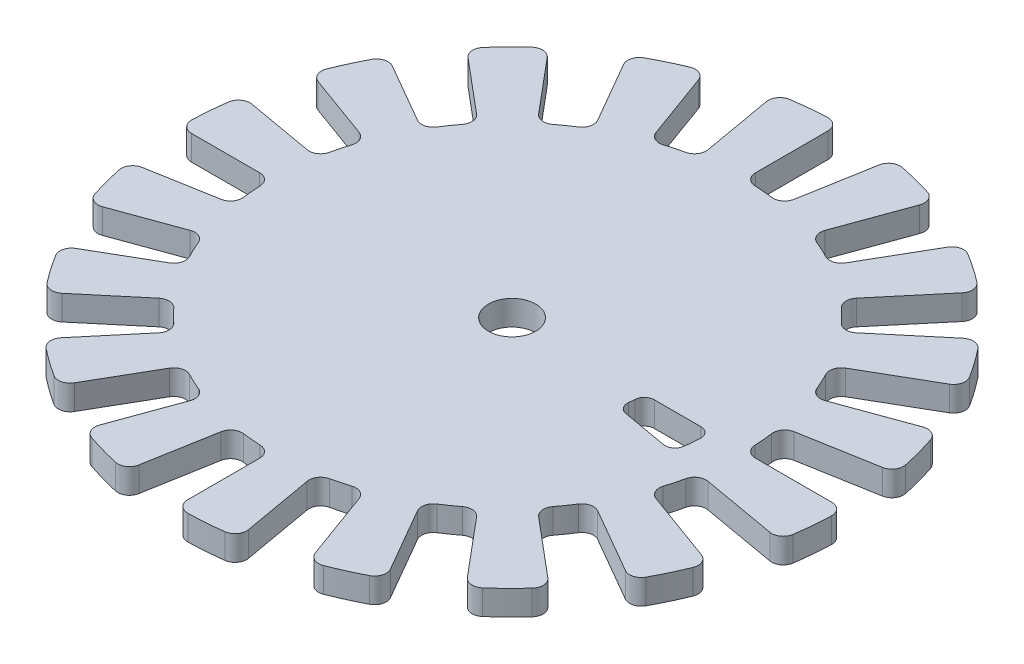
from build123d import *

# Parameters (mm, degrees)
SKETCH1_R               = 20
BASE_FLANGE1_DEPTH      = 1.5
CUT_EXTRUDE1_DEPTH      = 29.324018077
FILLET2_R               = 0.7
CIRPATTERN1_START       = -1.5
CIRPATTERN1_DEPTH       = 1.5
CUT_EXTRUDE2_DEPTH      = 29.312718395
CUT_EXTRUDE2_DEPTH_BACK = 29.312718395
SKETCH9_R               = 1.425
CUT_EXTRUDE3_DEPTH      = 29.312718395
CUT_EXTRUDE3_DEPTH_BACK = 29.312718395
FILLET3_R               = 0.6


# Read off the part's stored shape, not the designer's step: CirPattern1
# Sheet-metal steps are written as plain solids
with BuildPart() as part:
    # Sketch1 → Base-Flange1 (new body)
    with BuildSketch(Plane(origin=(0, 0, 0), x_dir=(1, 0, 0), z_dir=(0, 1, 0))):
        with Locations(Location((0, 0, 0), (0, 0, 270))):
            Circle(SKETCH1_R)
    extrude(amount=-BASE_FLANGE1_DEPTH)

    # Sketch8 → Cut-Extrude1 (cut, symmetric)
    with BuildSketch(Plane(origin=(0, 0, 0), x_dir=(1, 0, 0), z_dir=(0, 1, 0))):
        with BuildLine():
            Line((13.787308542, 2.431074487), (19.69615506, 3.472963553))
            ThreePointArc((19.69615506, 3.472963553), (19.923893962, 1.743114855), (20, 0))
            Line((20, 0), (14, 0))
            ThreePointArc((14, 0), (13.946725773, 1.220180398), (13.787308542, 2.431074487))
        make_face()
    extrude(amount=CUT_EXTRUDE1_DEPTH, both=True, mode=Mode.SUBTRACT)

    # Fillet2
    fillet2_edges = [part.edges().sort_by_distance(p)[0] for p in [
        (19.69615506, -0.75, -3.472963553),
        (20, -0.75, 0),
        (14, -0.75, 0),
        (13.787308542, -0.75, -2.431074487),
    ]]
    fillet(fillet2_edges, radius=FILLET2_R)

    # CirPattern1 outline → CirPattern1 (cut)
    with BuildSketch(Plane(origin=(0, 0, 0), x_dir=(1, 0, 0), z_dir=(0, 1, 0)).offset(CIRPATTERN1_START)):
        with BuildLine():
            ThreePointArc((12.890480997, 5.492454574), (13.255479493, 5.121639026), (13.775533049, 5.105135328))
            Line((13.775533049, 5.105135328), (18.097552381, 6.678221717))
            ThreePointArc((18.097552381, 6.678221717), (18.642858692, 6.650063721), (19.002037805, 6.238794697))
            ThreePointArc((19.002037805, 6.238794697), (18.088975146, 8.531645689), (16.900469443, 10.694584265))
            ThreePointArc((16.900469443, 10.694584265), (16.988638381, 10.152858765), (16.658953013, 9.714056033))
            Line((16.658953013, 9.714056033), (12.693853443, 7.424804729))
            ThreePointArc((12.693853443, 7.424804729), (12.372212027, 7.01581222), (12.421656706, 6.497851511))
            ThreePointArc((12.421656706, 6.497851511), (12.666030974, 5.999798457), (12.890480997, 5.492454574))
        make_face()
        with BuildLine():
            ThreePointArc((18.092694212, -6.673680862), (18.493568214, -7.048567931), (18.500808406, -7.597373779))
            ThreePointArc((18.500808406, -7.597373779), (19.295667694, -5.26091325), (19.796709483, -2.84434415))
            ThreePointArc((19.796709483, -2.84434415), (19.514403225, -3.311735872), (18.982270927, -3.434157532))
            Line((18.982270927, -3.434157532), (14.452749195, -2.635480641))
            ThreePointArc((14.452749195, -2.635480641), (13.943462259, -2.742039963), (13.648400354, -3.170603313))
            ThreePointArc((13.648400354, -3.170603313), (13.515459572, -3.709214839), (13.361283903, -4.242136495))
            ThreePointArc((13.361283903, -4.242136495), (13.402533333, -4.760814196), (13.790309097, -5.107740744))
            Line((13.790309097, -5.107740744), (18.092694212, -6.673680862))
        make_face()
        with BuildLine():
            ThreePointArc((14.671423123, -12.511364069), (14.919987016, -13.002026687), (14.737276473, -13.520824019))
            ThreePointArc((14.737276473, -13.520824019), (16.28809363, -11.605947006), (17.591666165, -9.514897873))
            ThreePointArc((17.591666165, -9.514897873), (17.166507816, -9.855442116), (16.62595785, -9.78809423))
            Line((16.62595785, -9.78809423), (12.672252306, -7.50542127))
            ThreePointArc((12.672252306, -7.50542127), (12.157233695, -7.431367887), (11.733388902, -7.73316859))
            ThreePointArc((11.733388902, -7.73316859), (11.424249439, -8.193829442), (11.097101759, -8.641880804))
            ThreePointArc((11.097101759, -8.641880804), (10.958465323, -9.143386549), (11.20419948, -9.602017988))
            Line((11.20419948, -9.602017988), (14.671423123, -12.511364069))
        make_face()
        with BuildLine():
            ThreePointArc((9.463608356, -16.797496384), (9.5291139, -17.344442499), (9.178643081, -17.769426304))
            ThreePointArc((9.178643081, -17.769426304), (11.289201227, -16.509207602), (13.229218861, -14.999592272))
            ThreePointArc((13.229218861, -14.999592272), (12.713780462, -15.172641348), (12.229965091, -14.924557869))
            Line((12.229965091, -14.924557869), (9.333514726, -11.472702741))
            ThreePointArc((9.333514726, -11.472702741), (8.874883287, -11.226968585), (8.373377543, -11.365605021))
            ThreePointArc((8.373377543, -11.365605021), (7.92532618, -11.692752701), (7.464665328, -12.001892164))
            ThreePointArc((7.464665328, -12.001892164), (7.162864626, -12.425736957), (7.236918008, -12.940755568))
            Line((7.236918008, -12.940755568), (9.463608356, -16.797496384))
        make_face()
        with BuildLine():
            ThreePointArc((3.125677784, -19.024056271), (2.9999265, -19.560747441), (2.524676018, -19.840010358))
            ThreePointArc((2.524676018, -19.840010358), (4.932432972, -19.382236842), (7.266118961, -18.633397845))
            ThreePointArc((7.266118961, -18.633397845), (6.723206839, -18.618968066), (6.354019963, -18.22064302))
            Line((6.354019963, -18.22064302), (4.839237482, -14.058812359))
            ThreePointArc((4.839237482, -14.058812359), (4.492310934, -13.671036595), (3.973633233, -13.629787164))
            ThreePointArc((3.973633233, -13.629787164), (3.440711578, -13.783962834), (2.902100051, -13.916903615))
            ThreePointArc((2.902100051, -13.916903615), (2.473536701, -14.211965521), (2.366977379, -14.721252457))
            Line((2.366977379, -14.721252457), (3.125677784, -19.024056271))
        make_face()
        with BuildLine():
            ThreePointArc((-3.562108353, -18.947465938), (-3.863721694, -19.408705762), (-4.405672311, -19.50871732))
            ThreePointArc((-4.405672311, -19.50871732), (-1.994141124, -19.900336711), (0.447146879, -19.995000867))
            ThreePointArc((0.447146879, -19.995000867), (-0.057913571, -19.795653158), (-0.268503262, -19.295175837))
            Line((-0.268503262, -19.295175837), (-0.268503262, -14.951827136))
            ThreePointArc((-0.268503262, -14.951827136), (-0.461880457, -14.468781245), (-0.935169928, -14.252621237))
            ThreePointArc((-0.935169928, -14.252621237), (-1.48868366, -14.215229035), (-2.040281363, -14.155936515))
            ThreePointArc((-2.040281363, -14.155936515), (-2.543916295, -14.286626712), (-2.818235695, -14.728754453))
            Line((-2.818235695, -14.728754453), (-3.562108353, -18.947465938))
        make_face()
        with BuildLine():
            ThreePointArc((-9.797047112, -16.606139749), (-10.237582538, -16.936249561), (-10.780585383, -16.845740672))
            ThreePointArc((-10.780585383, -16.845740672), (-8.652784691, -18.031342632), (-6.396637507, -18.949486236))
            ThreePointArc((-6.396637507, -18.949486236), (-6.803648802, -18.589525147), (-6.830540029, -18.046840117))
            Line((-6.830540029, -18.046840117), (-5.37363859, -14.044036311))
            ThreePointArc((-5.37363859, -14.044036311), (-5.390142288, -13.523982756), (-5.760957835, -13.158984259))
            ThreePointArc((-5.760957835, -13.158984259), (-6.268301718, -12.934534236), (-6.766354773, -12.690159967))
            ThreePointArc((-6.766354773, -12.690159967), (-7.284315482, -12.640715289), (-7.693307991, -12.962356705))
            Line((-7.693307991, -12.962356705), (-9.797047112, -16.606139749))
        make_face()
        with BuildLine():
            ThreePointArc((-14.848781899, -12.302231352), (-15.374555749, -12.461881657), (-15.853609561, -12.192746364))
            ThreePointArc((-15.853609561, -12.192746364), (-14.258017404, -14.025296422), (-12.451971419, -15.650827703))
            ThreePointArc((-12.451971419, -15.650827703), (-12.712634142, -15.173143026), (-12.55238353, -14.653097406))
            Line((-12.55238353, -14.653097406), (-9.860413838, -11.444932855))
            ThreePointArc((-9.860413838, -11.444932855), (-9.698053449, -10.950597769), (-9.921669245, -10.480784989))
            ThreePointArc((-9.921669245, -10.480784989), (-10.321650119, -10.096349131), (-10.706085976, -9.696368257))
            ThreePointArc((-10.706085976, -9.696368257), (-11.175898757, -9.472752462), (-11.670233843, -9.63511285))
            Line((-11.670233843, -9.63511285), (-14.848781899, -12.302231352))
        make_face()
        with BuildLine():
            ThreePointArc((-18.137191314, -6.556121334), (-18.684589907, -6.526942538), (-19.043114419, -6.112265802))
            ThreePointArc((-19.043114419, -6.112265802), (-18.162986153, -8.37292864), (-17.015624862, -10.510400114))
            ThreePointArc((-17.015624862, -10.510400114), (-17.098844191, -9.971432494), (-16.770077992, -9.536318327))
            Line((-16.770077992, -9.536318327), (-13.187657693, -7.468007003))
            ThreePointArc((-13.187657693, -7.468007003), (-12.866016277, -7.059014494), (-12.915460955, -6.541053785))
            ThreePointArc((-12.915460955, -6.541053785), (-13.159835224, -6.043000731), (-13.384285247, -5.535656848))
            ThreePointArc((-13.384285247, -5.535656848), (-13.749283743, -5.1648413), (-14.269337299, -5.148337602))
            Line((-14.269337299, -5.148337602), (-18.137191314, -6.556121334))
        make_face()
        with BuildLine():
            ThreePointArc((-19.288821031, -0.043202274), (-19.792147552, 0.170318115), (-19.988415576, 0.680619405))
            ThreePointArc((-19.988415576, 0.680619405), (-19.923893962, -1.743114855), (-19.56655831, -4.141231206))
            ThreePointArc((-19.56655831, -4.141231206), (-19.461884928, -3.604600954), (-19.003282493, -3.306922687))
            Line((-19.003282493, -3.306922687), (-14.954055441, -2.592934707))
            ThreePointArc((-14.954055441, -2.592934707), (-14.5119277, -2.318615307), (-14.381237503, -1.814980375))
            ThreePointArc((-14.381237503, -1.814980375), (-14.440530023, -1.263382673), (-14.477922225, -0.709868941))
            ThreePointArc((-14.477922225, -0.709868941), (-14.694082233, -0.236579469), (-15.177128124, -0.043202274))
            Line((-15.177128124, -0.043202274), (-19.288821031, -0.043202274))
        make_face()
        with BuildLine():
            ThreePointArc((-18.171267124, 6.479346741), (-18.570595408, 6.850760895), (-18.582231113, 7.39599127))
            ThreePointArc((-18.582231113, 7.39599127), (-19.340993381, 5.091755594), (-19.815190539, 2.712604635))
            ThreePointArc((-19.815190539, 2.712604635), (-19.534120679, 3.183238628), (-19.000105146, 3.3070289))
            Line((-19.000105146, 3.3070289), (-14.946553445, 2.592278367))
            ThreePointArc((-14.946553445, 2.592278367), (-14.437266509, 2.698837689), (-14.142204603, 3.127401039))
            ThreePointArc((-14.142204603, 3.127401039), (-14.009263822, 3.666012566), (-13.855088152, 4.198934221))
            ThreePointArc((-13.855088152, 4.198934221), (-13.896337583, 4.717611922), (-14.284113347, 5.06453847))
            Line((-14.284113347, 5.06453847), (-18.171267124, 6.479346741))
        make_face()
        with BuildLine():
            ThreePointArc((-14.906168281, 12.250785406), (-15.1542893, 12.735103137), (-14.980535703, 13.250794317))
            ThreePointArc((-14.980535703, 13.250794317), (-16.476873246, 11.336341915), (-17.730005795, 9.25456074))
            ThreePointArc((-17.730005795, 9.25456074), (-17.304964741, 9.602794085), (-16.759455593, 9.536868897))
            Line((-16.759455593, 9.536868897), (-13.166056556, 7.462218996))
            ThreePointArc((-13.166056556, 7.462218996), (-12.651037945, 7.388165614), (-12.227193152, 7.689966316))
            ThreePointArc((-12.227193152, 7.689966316), (-11.918053689, 8.150627168), (-11.590906009, 8.598678531))
            ThreePointArc((-11.590906009, 8.598678531), (-11.452269573, 9.100184275), (-11.698003729, 9.558815714))
            Line((-11.698003729, 9.558815714), (-14.906168281, 12.250785406))
        make_face()
        with BuildLine():
            ThreePointArc((-9.860569677, 16.586557236), (-9.928323254, 17.125667273), (-9.590001963, 17.550836514))
            ThreePointArc((-9.590001963, 17.550836514), (-11.652439238, 16.254865727), (-13.542036237, 14.717787013))
            ThreePointArc((-13.542036237, 14.717787013), (-13.022999528, 14.901212323), (-12.531833858, 14.652615794))
            Line((-12.531833858, 14.652615794), (-9.827318976, 11.429500467))
            ThreePointArc((-9.827318976, 11.429500467), (-9.368687536, 11.183766311), (-8.867181792, 11.322402747))
            ThreePointArc((-8.867181792, 11.322402747), (-8.41913043, 11.649550427), (-7.958469578, 11.95868989))
            ThreePointArc((-7.958469578, 11.95868989), (-7.656668875, 12.382534683), (-7.730722258, 12.897553294))
            Line((-7.730722258, 12.897553294), (-9.860569677, 16.586557236))
        make_face()
        with BuildLine():
            ThreePointArc((-3.614996216, 18.955413658), (-3.49451283, 19.48485612), (-3.03174175, 19.768878116))
            ThreePointArc((-3.03174175, 19.768878116), (-5.419502844, 19.251726907), (-7.726393461, 18.4472991))
            ThreePointArc((-7.726393461, 18.4472991), (-7.175309467, 18.442915679), (-6.798184855, 18.041057732))
            Line((-6.798184855, 18.041057732), (-5.333041732, 14.015610085))
            ThreePointArc((-5.333041732, 14.015610085), (-4.986115184, 13.627834321), (-4.467437483, 13.586584891))
            ThreePointArc((-4.467437483, 13.586584891), (-3.934515828, 13.74076056), (-3.395904301, 13.873701341))
            ThreePointArc((-3.395904301, 13.873701341), (-2.967340951, 14.168763247), (-2.860781629, 14.678050183))
            Line((-2.860781629, 14.678050183), (-3.614996216, 18.955413658))
        make_face()
        with BuildLine():
            ThreePointArc((3.093506666, 19.047194499), (3.387916345, 19.50357672), (3.920074708, 19.612062979))
            ThreePointArc((3.920074708, 19.612062979), (1.491808125, 19.944285109), (-0.958861127, 19.977001409))
            ThreePointArc((-0.958861127, 19.977001409), (-0.442337272, 19.784507504), (-0.225300988, 19.277806361))
            Line((-0.225300988, 19.277806361), (-0.225300988, 14.908624862))
            ThreePointArc((-0.225300988, 14.908624862), (-0.031923793, 14.425578971), (0.441365679, 14.209418964))
            ThreePointArc((0.441365679, 14.209418964), (0.994879411, 14.172026761), (1.546477113, 14.112734241))
            ThreePointArc((1.546477113, 14.112734241), (2.050112045, 14.243424438), (2.324431445, 14.685552179))
            Line((2.324431445, 14.685552179), (3.093506666, 19.047194499))
        make_face()
        with BuildLine():
            ThreePointArc((9.452542164, 16.821531451), (9.885928049, 17.149859642), (10.423585437, 17.068944509))
            ThreePointArc((10.423585437, 17.068944509), (8.250899079, 18.218744862), (5.953570373, 19.093323435))
            ThreePointArc((5.953570373, 19.093323435), (6.372514416, 18.735654708), (6.402980244, 18.185643015))
            Line((6.402980244, 18.185643015), (4.87983434, 14.000834037))
            ThreePointArc((4.87983434, 14.000834037), (4.896338038, 13.480780481), (5.267153586, 13.115781985))
            ThreePointArc((5.267153586, 13.115781985), (5.774497469, 12.891331962), (6.272550523, 12.646957694))
            ThreePointArc((6.272550523, 12.646957694), (6.790511232, 12.597513015), (7.199503741, 12.919154431))
            Line((7.199503741, 12.919154431), (9.452542164, 16.821531451))
        make_face()
        with BuildLine():
            ThreePointArc((14.673687466, 12.526458367), (15.194330426, 12.686648604), (15.672164552, 12.425105966))
            ThreePointArc((15.672164552, 12.425105966), (14.02528934, 14.258024368), (12.165517676, 15.874513524))
            ThreePointArc((12.165517676, 15.874513524), (12.435540648, 15.395325243), (12.275955669, 14.868954225))
            Line((12.275955669, 14.868954225), (9.366609588, 11.401730581))
            ThreePointArc((9.366609588, 11.401730581), (9.2042492, 10.907395495), (9.427864995, 10.437582715))
            ThreePointArc((9.427864995, 10.437582715), (9.827845869, 10.053146857), (10.212281727, 9.653165983))
            ThreePointArc((10.212281727, 9.653165983), (10.682094507, 9.429550188), (11.176429593, 9.591910576))
            Line((11.176429593, 9.591910576), (14.673687466, 12.526458367))
        make_face()
    extrude(amount=CIRPATTERN1_DEPTH, mode=Mode.SUBTRACT)

    # Sketch9 → Cut-Extrude2 (cut, two sides: drawn at the far end of the back side and taken through both)
    with BuildSketch(Plane(origin=(0, 0, 0), x_dir=(1, 0, 0), z_dir=(0, 1, 0)).offset(-CUT_EXTRUDE2_DEPTH_BACK)):
        with Locations(Location((0, 0, 0), (0, 0, 270))):
            Circle(SKETCH9_R)
    extrude(amount=CUT_EXTRUDE2_DEPTH + CUT_EXTRUDE2_DEPTH_BACK, mode=Mode.SUBTRACT)

    # Sketch11 → Cut-Extrude3 (cut, two sides: drawn at the far end of the back side and taken through both)
    with BuildSketch(Plane(origin=(0, 0, 0), x_dir=(1, 0, 0), z_dir=(0, 1, 0)).offset(-CUT_EXTRUDE3_DEPTH_BACK)):
        with BuildLine():
            Line((8, 0), (12, 0))
            ThreePointArc((12, 0), (11.950523328, -1.088573465), (11.802501302, -2.168170432))
            Line((11.802501302, -2.168170432), (7.863119425, -1.47355112))
            ThreePointArc((7.863119425, -1.47355112), (7.965706353, -0.739947497), (8, 0))
        make_face()
    extrude(amount=CUT_EXTRUDE3_DEPTH + CUT_EXTRUDE3_DEPTH_BACK, mode=Mode.SUBTRACT)

    # Fillet3
    fillet3_edges = [part.edges().sort_by_distance(p)[0] for p in [
        (12, -0.75, 0),
        (11.802501302, -0.75, 2.168170432),
        (7.863119425, -0.75, 1.47355112),
        (8, -0.75, 0),
    ]]
    fillet(fillet3_edges, radius=FILLET3_R)


solid = part.part
